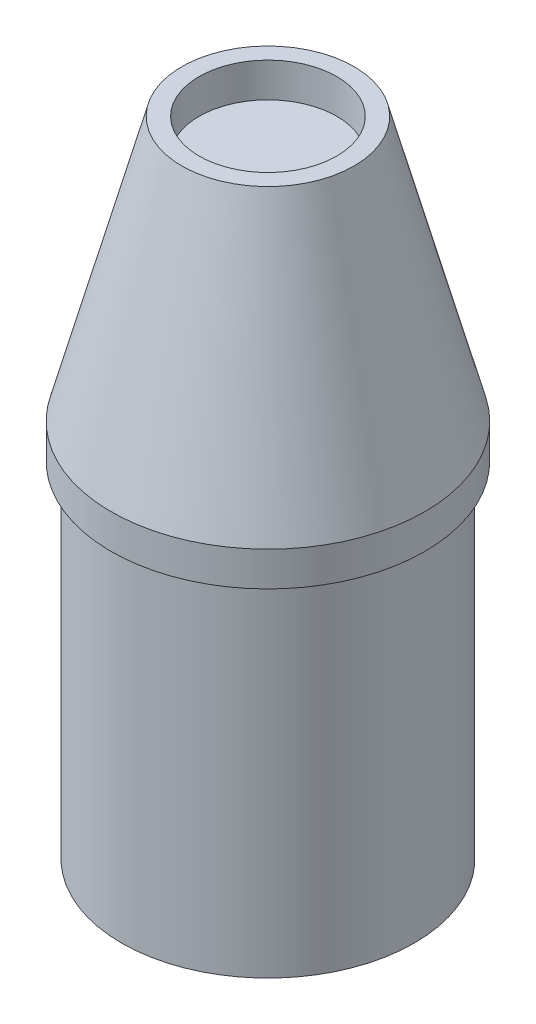
from build123d import *


with BuildPart() as part:
    # Sketch1 → Revolve1 (revolve)
    with BuildSketch(Plane.XY):
        Polygon((0, -16.949725563), (0, 95.227039915), (12.7, 95.227039915), (12.7, 101.577039915), (15.875, 101.577039915), (28.9179, 52.900274437), (28.9179, 46.550274437), (26.9875, 46.550274437), (26.9875, -16.949725563), align=None)
    revolve(axis=Axis((0, -16.949725563, 0), (0, 1, 0)))


solid = part.part
